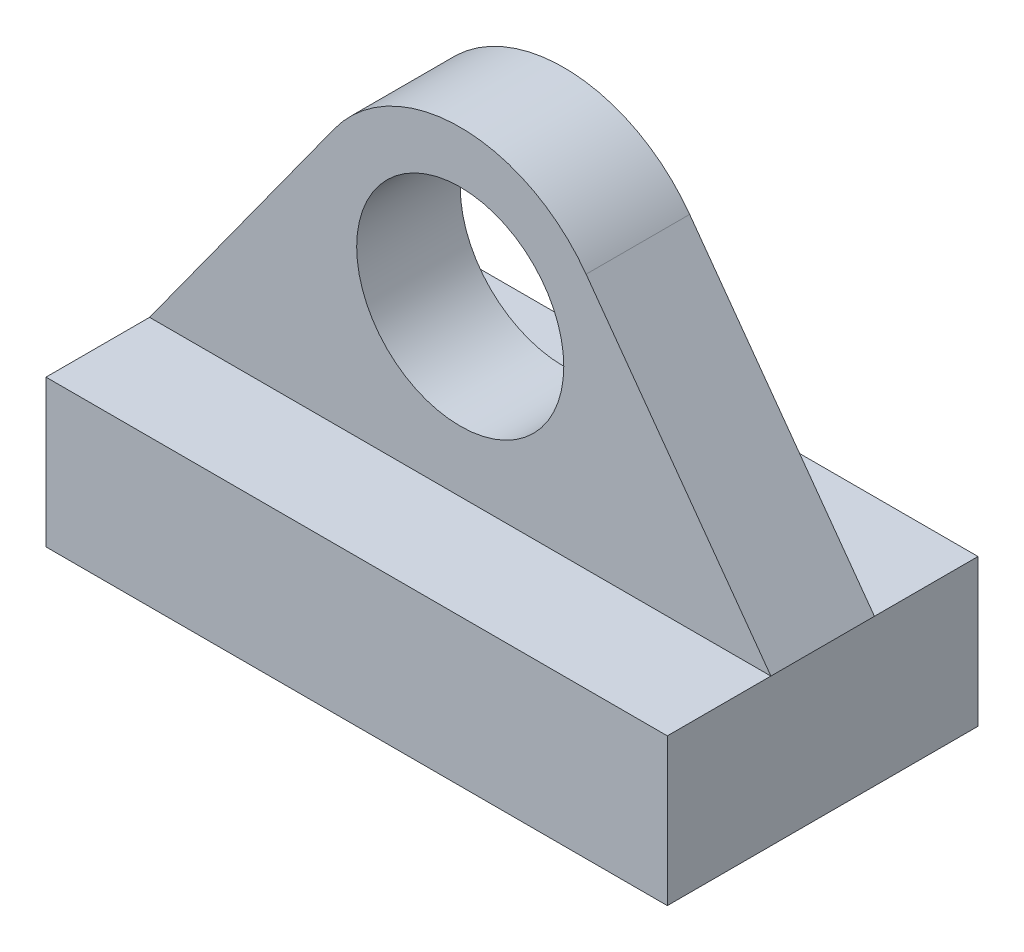
from build123d import *

# Parameters (mm, degrees)
SKETCH1_W           = 38.1
SKETCH1_H           = 9.017
BOSS_EXTRUDE1_DEPTH = 9.525
SKETCH2_R           = 6.35
BOSS_EXTRUDE2_DEPTH = 3.175


with BuildPart() as part:
    # Sketch1 → Boss-Extrude1 (new, symmetric)
    with BuildSketch(Plane.XY):
        Rectangle(SKETCH1_W, SKETCH1_H)
    extrude(amount=BOSS_EXTRUDE1_DEPTH, both=True)

    # Sketch2 → Boss-Extrude2 (add, symmetric)
    with BuildSketch(Plane.XY):
        with BuildLine():
            Line((-19.05, 4.5085), (-7.719690905, 20.184605481))
            ThreePointArc((-7.719690905, 20.184605481), (0, 24.13), (7.719690905, 20.184605481))
            Line((7.719690905, 20.184605481), (19.05, 4.5085))
            Line((19.05, 4.5085), (-19.05, 4.5085))
        make_face()
        with Locations((0, 14.605)):
            Circle(SKETCH2_R, mode=Mode.SUBTRACT)
    extrude(amount=BOSS_EXTRUDE2_DEPTH, both=True)


solid = part.part
